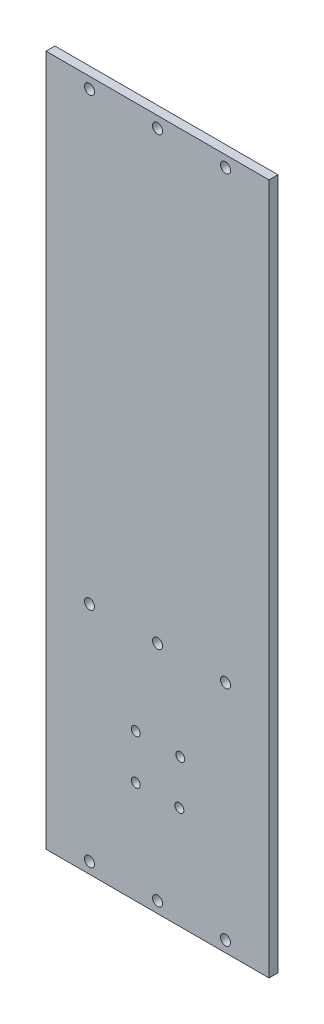
from build123d import *

# Parameters (mm, degrees)
SCHIZZO1_W                   = 100
SCHIZZO1_H                   = 310
SCHIZZO1_R                   = 2.25
SCHIZZO1_R_2                 = 2
ESTRUSIONE_ESTRUSIONE1_DEPTH = 4


with BuildPart() as part:
    # Schizzo1 → Estrusione-Estrusione1 (new body)
    with BuildSketch(Plane.XY):
        with Locations((50, 155)):
            Rectangle(SCHIZZO1_W, SCHIZZO1_H)
        with Locations((80.5, 5)):
            Circle(SCHIZZO1_R, mode=Mode.SUBTRACT)
        with Locations((50, 5)):
            Circle(SCHIZZO1_R, mode=Mode.SUBTRACT)
        with Locations((19.5, 5)):
            Circle(SCHIZZO1_R, mode=Mode.SUBTRACT)
        with Locations((19.5, 305)):
            Circle(SCHIZZO1_R, mode=Mode.SUBTRACT)
        with Locations((50, 305)):
            Circle(SCHIZZO1_R, mode=Mode.SUBTRACT)
        with Locations((80.5, 305)):
            Circle(SCHIZZO1_R, mode=Mode.SUBTRACT)
        with Locations((40.207634416, 46)):
            Circle(SCHIZZO1_R_2, mode=Mode.SUBTRACT)
        with Locations((59.792365584, 46)):
            Circle(SCHIZZO1_R_2, mode=Mode.SUBTRACT)
        with Locations((40.207634416, 66)):
            Circle(SCHIZZO1_R_2, mode=Mode.SUBTRACT)
        with Locations((60.207634416, 66)):
            Circle(SCHIZZO1_R_2, mode=Mode.SUBTRACT)
        with Locations((50, 105)):
            Circle(SCHIZZO1_R, mode=Mode.SUBTRACT)
        with Locations((80.5, 105)):
            Circle(SCHIZZO1_R, mode=Mode.SUBTRACT)
        with Locations((19.5, 105)):
            Circle(SCHIZZO1_R, mode=Mode.SUBTRACT)
    extrude(amount=-ESTRUSIONE_ESTRUSIONE1_DEPTH)


solid = part.part
